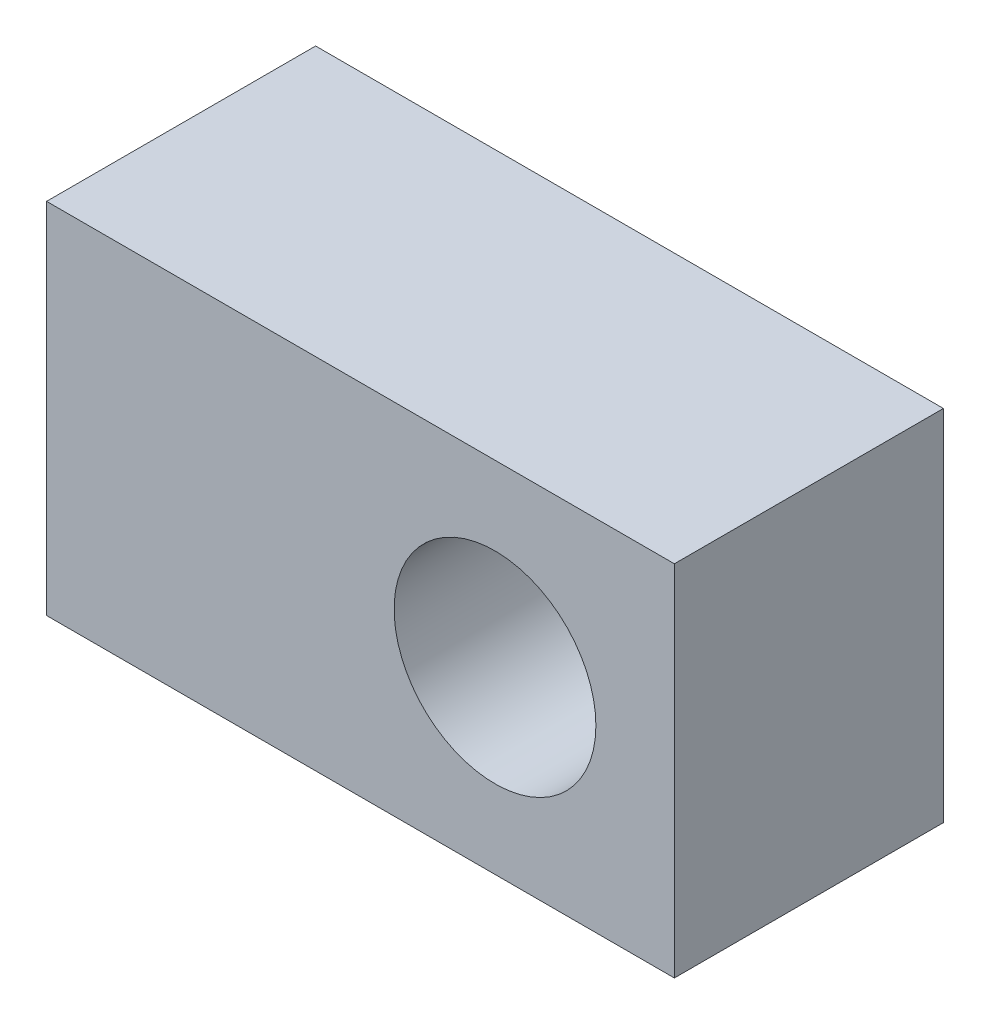
from build123d import *

# Parameters (mm, degrees)
SKETCH2_W               = 88.9
SKETCH2_H               = 50.8
BOSS_EXTRUDE1_DEPTH     = 38.1
CUT_EXTRUDE1_DEPTH      = 110.249530891
CUT_EXTRUDE1_DEPTH_BACK = 110.249530891
SKETCH3_R               = 14.2875
SKETCH4_R               = 12.7
CUT_EXTRUDE2_DEPTH      = 38.1


with BuildPart() as part:
    # Sketch2 → Boss-Extrude1 (new body)
    with BuildSketch(Plane.XY):
        with Locations((44.45, 25.4)):
            Rectangle(SKETCH2_W, SKETCH2_H)
    extrude(amount=BOSS_EXTRUDE1_DEPTH)

    # Sketch3 → Cut-Extrude1 (cut, two sides: drawn at the far end of the back side and taken through both)
    with BuildSketch(Plane.XY.offset(38.1).offset(-CUT_EXTRUDE1_DEPTH_BACK)):
        with Locations((63.5, 25.4)):
            Circle(SKETCH3_R)
    extrude(amount=CUT_EXTRUDE1_DEPTH + CUT_EXTRUDE1_DEPTH_BACK, mode=Mode.SUBTRACT)

    # Sketch4 → Cut-Extrude2 (cut)
    with BuildSketch(Plane.ZY):
        with Locations((19.05, 25.4)):
            Circle(SKETCH4_R)
    extrude(amount=-CUT_EXTRUDE2_DEPTH, mode=Mode.SUBTRACT)


solid = part.part
